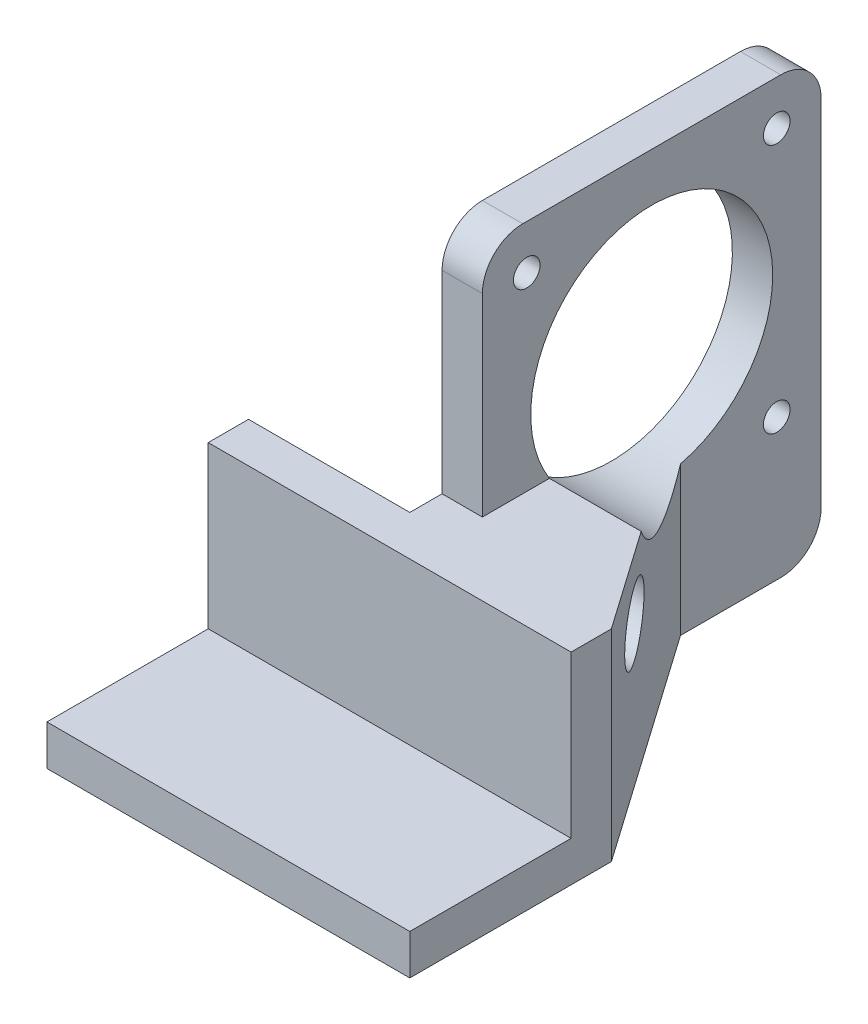
from build123d import *

# Parameters (mm, degrees)
SKETCH1_W               = 45
SKETCH1_H               = 25
BOSS_EXTRUDE1_DEPTH     = 5
SKETCH2_W               = 5
SKETCH2_H               = 25
BOSS_EXTRUDE2_DEPTH     = 46
SKETCH3_W               = 45
SKETCH3_H               = 5
BOSS_EXTRUDE3_DEPTH     = 20
CHAMFER2_SIZE2          = 20
CHAMFER2_SIZE           = 28.562960135
CHAMFER3_SIZE2          = 20
CHAMFER3_SIZE           = 28.562960135
SKETCH4_W               = 5
SKETCH4_H               = 42
BOSS_EXTRUDE4_DEPTH     = 29
CUT_EXTRUDE1_DEPTH      = 76.213030786
CUT_EXTRUDE1_DEPTH_BACK = 76.213030786
SKETCH6_R               = 15
SKETCH7_W               = 46
SKETCH7_H               = 44
CUT_EXTRUDE2_DEPTH      = 76.213030786
SKETCH8_R               = 1.65
CUT_EXTRUDE3_DEPTH      = 76.213030786
SKETCH9_R               = 4
CUT_EXTRUDE4_DEPTH      = 76.213030786
FILLET1_R               = 5


with BuildPart() as part:
    # Sketch1 → Boss-Extrude1 (new body)
    with BuildSketch(Plane.XY):
        with Locations((22.5, 12.5)):
            Rectangle(SKETCH1_W, SKETCH1_H)
    extrude(amount=BOSS_EXTRUDE1_DEPTH)

    # Sketch2 → Boss-Extrude2 (add)
    with BuildSketch(Plane(origin=(0, 0, 0), x_dir=(-1, 0, 0), z_dir=(0, 0, -1))):
        with Locations((-22.5, 12.5)):
            Rectangle(SKETCH2_W, SKETCH2_H)
    extrude(amount=BOSS_EXTRUDE2_DEPTH)

    # Sketch3 → Boss-Extrude3 (add)
    with BuildSketch(Plane.XY.offset(5)):
        with Locations((22.5, 2.5)):
            Rectangle(SKETCH3_W, SKETCH3_H)
    extrude(amount=BOSS_EXTRUDE3_DEPTH)

    # Chamfer2
    chamfer2_edges = [part.edges().sort_by_distance(p)[0] for p in [
        (25, 12.5, 0),
    ]]
    chamfer2_side = [part.faces().sort_by_distance(p)[0] for p in [
        (25, 12.5, -0.4),
    ]]
    chamfer(chamfer2_edges, length=CHAMFER2_SIZE - 0.0001, length2=CHAMFER2_SIZE2 - 0.0001, reference=chamfer2_side[0])  # a hair under: the kernel refuses the full size

    # Chamfer3
    chamfer3_edges = [part.edges().sort_by_distance(p)[0] for p in [
        (20, 12.5, 0),
    ]]
    chamfer3_side = [part.faces().sort_by_distance(p)[0] for p in [
        (20, 12.5, -0.4),
    ]]
    chamfer(chamfer3_edges, length=CHAMFER3_SIZE - 0.0001, length2=CHAMFER3_SIZE2 - 0.0001, reference=chamfer3_side[0])  # a hair under: the kernel refuses the full size

    # Sketch4 → Boss-Extrude4 (add)
    with BuildSketch(Plane(origin=(0, 25, 0), x_dir=(1, 0, 0), z_dir=(0, 1, 0))):
        with Locations((22.5, 25)):
            Rectangle(SKETCH4_W, SKETCH4_H)
    extrude(amount=BOSS_EXTRUDE4_DEPTH)

    # Sketch6 → Cut-Extrude1 (cut, two sides: drawn at the far end of the back side and taken through both)
    with BuildSketch(Plane(origin=(25, 0, 0), x_dir=(0, 0, -1), z_dir=(1, 0, 0)).offset(-CUT_EXTRUDE1_DEPTH_BACK)):
        with Locations(Location((25, 33, 0), (0, 0, 283.740844537))):
            Circle(SKETCH6_R)
    extrude(amount=CUT_EXTRUDE1_DEPTH + CUT_EXTRUDE1_DEPTH_BACK, mode=Mode.SUBTRACT)

    # Sketch7 → Cut-Extrude2 (cut, through all)
    with BuildSketch(Plane.ZY.offset(-20)):
        with Locations((-23, 32)):
            Rectangle(SKETCH7_W, SKETCH7_H)
    extrude(amount=CUT_EXTRUDE2_DEPTH, mode=Mode.SUBTRACT)

    # Sketch8 → Cut-Extrude3 (cut, through all)
    with BuildSketch(Plane.ZY.offset(-20)):
        with Locations(Location((-40.5, 48.5, 0), (0, 0, 270))):
            Circle(SKETCH8_R)
        with Locations(Location((-9.5, 48.5, 0), (0, 0, 270))):
            Circle(SKETCH8_R)
        with Locations(Location((-9.5, 17.5, 0), (0, 0, 270))):
            Circle(SKETCH8_R)
        with Locations(Location((-40.5, 17.5, 0), (0, 0, 270))):
            Circle(SKETCH8_R)
    extrude(amount=-CUT_EXTRUDE3_DEPTH, mode=Mode.SUBTRACT)

    # Sketch9 → Cut-Extrude4 (cut, through all)
    with BuildSketch(Plane(origin=(25, 0, 0), x_dir=(0, 0, -1), z_dir=(1, 0, 0))):
        with Locations((9.5, 17.5)):
            Circle(SKETCH9_R)
    extrude(amount=CUT_EXTRUDE4_DEPTH, mode=Mode.SUBTRACT)

    # Fillet1
    fillet1_edges = [part.edges().sort_by_distance(p)[0] for p in [
        (22.5, 0, -46),
        (22.5, 54, -4),
        (22.5, 54, -46),
    ]]
    fillet(fillet1_edges, radius=FILLET1_R)


solid = part.part
